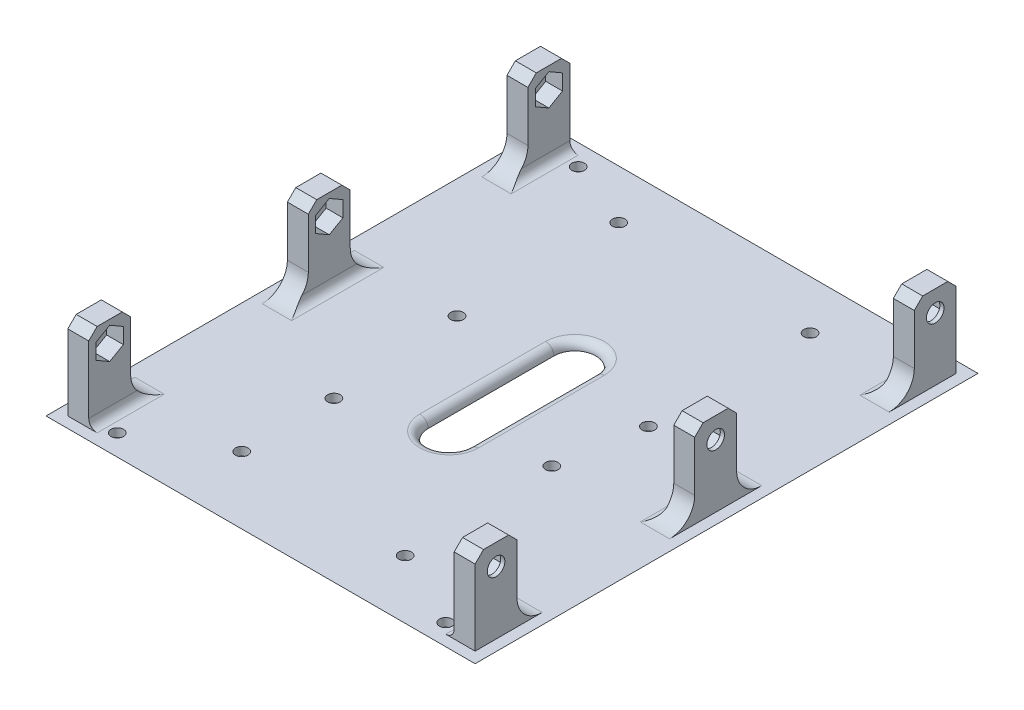
from build123d import *

# Parameters (mm, degrees)
SKETCH1_W               = 130.048
SKETCH1_H               = 152.4
BOSS_EXTRUDE1_DEPTH     = 2.54
CHAMFER1_SIZE           = 2.54
SKETCH4_W               = 6.35
SKETCH4_H               = 12.7
BOSS_EXTRUDE4_DEPTH     = 25.4
CUT_EXTRUDE2_DEPTH      = 104.996173853
CUT_EXTRUDE2_DEPTH_BACK = 104.996173853
SKETCH5_R               = 2.667
CUT_EXTRUDE3_DEPTH      = 60.452
CUT_EXTRUDE3_DEPTH_BACK = 60.452
SKETCH5_3_R             = 2.667
FILLET1_R               = 7.62
FILLET2_R               = 2.54
CHAMFER2_SIZE           = 2.54
SKETCH6_R               = 1.905
CUT_EXTRUDE4_DEPTH      = 104.996173853
SKETCH8_R               = 1.905
CUT_EXTRUDE5_DEPTH      = 2.54
SKETCH9_R               = 1.905
CUT_EXTRUDE6_DEPTH      = 104.996173853
CUT_EXTRUDE7_DEPTH      = 104.996173853
FILLET3_R               = 2.54


with BuildPart() as part:
    # Sketch1 → Boss-Extrude1 (new body)
    with BuildSketch(Plane(origin=(0, 0, 0), x_dir=(1, 0, 0), z_dir=(0, 1, 0))):
        Rectangle(SKETCH1_W, SKETCH1_H)
    extrude(amount=BOSS_EXTRUDE1_DEPTH)

    # Chamfer1
    chamfer1_edges = [part.edges().sort_by_distance(p)[0] for p in [
        (0, 0, -76.2),
        (-65.024, 0, 0),
        (0, 0, 76.2),
        (65.024, 0, 0),
    ]]
    chamfer(chamfer1_edges, length=CHAMFER1_SIZE - 0.0001)  # a hair under: the kernel refuses the full size

    # Sketch4 → Boss-Extrude4 (add)
    with BuildSketch(Plane(origin=(0, 2.54, 0), x_dir=(1, 0, 0), z_dir=(0, 1, 0))):
        with Locations((-58.547, 66.548)):
            Rectangle(SKETCH4_W, SKETCH4_H)
        with Locations((-58.547, 0)):
            Rectangle(SKETCH4_W, SKETCH4_H)
        with Locations((-58.547, -66.548)):
            Rectangle(SKETCH4_W, SKETCH4_H)
        with Locations((58.547, -66.548)):
            Rectangle(SKETCH4_W, SKETCH4_H)
        with Locations((58.547, 0)):
            Rectangle(SKETCH4_W, SKETCH4_H)
        with Locations((58.547, 66.548)):
            Rectangle(SKETCH4_W, SKETCH4_H)
    extrude(amount=BOSS_EXTRUDE4_DEPTH)

    # Sketch5 → Cut-Extrude2 (cut, two sides: drawn at the far end of the back side and taken through both)
    with BuildSketch(Plane(origin=(0, 0, 0), x_dir=(0, 0, -1), z_dir=(1, 0, 0)).offset(-CUT_EXTRUDE2_DEPTH_BACK)):
        with Locations((-66.548, 21.59)):
            Circle(SKETCH5_R)
        with Locations((0, 21.59)):
            Circle(SKETCH5_R)
        with Locations((66.548, 21.59)):
            Circle(SKETCH5_R)
    extrude(amount=CUT_EXTRUDE2_DEPTH + CUT_EXTRUDE2_DEPTH_BACK, mode=Mode.SUBTRACT)

    # Sketch5<3> → Cut-Extrude3 (cut, two sides: drawn at the far end of the back side and taken through both)
    # profile 1 of 3: a face of its own
    with BuildSketch(Plane(origin=(0, 0, 0), x_dir=(0, 0, -1), z_dir=(1, 0, 0)).offset(-CUT_EXTRUDE3_DEPTH_BACK)):
        Polygon((0, 16.823973528), (4.1275, 19.206986764), (4.1275, 23.973013236), (0, 26.356026472), (-4.1275, 23.973013236), (-4.1275, 19.206986764), align=None)
        with Locations(Location((0, 21.59, 0), (0, 0, 180))):
            Circle(SKETCH5_3_R, mode=Mode.SUBTRACT)
    # profile 2 of 3: a face of its own
    with BuildSketch(Plane(origin=(0, 0, 0), x_dir=(0, 0, -1), z_dir=(1, 0, 0)).offset(-CUT_EXTRUDE3_DEPTH_BACK)):
        Polygon((-66.548, 16.823973528), (-62.4205, 19.206986764), (-62.4205, 23.973013236), (-66.548, 26.356026472), (-70.6755, 23.973013236), (-70.6755, 19.206986764), align=None)
        with Locations(Location((-66.548, 21.59, 0), (0, 0, 180))):
            Circle(SKETCH5_3_R, mode=Mode.SUBTRACT)
    # profile 3 of 3: a face of its own
    with BuildSketch(Plane(origin=(0, 0, 0), x_dir=(0, 0, -1), z_dir=(1, 0, 0)).offset(-CUT_EXTRUDE3_DEPTH_BACK)):
        Polygon((66.548, 16.823973528), (70.6755, 19.206986764), (70.6755, 23.973013236), (66.548, 26.356026472), (62.4205, 23.973013236), (62.4205, 19.206986764), align=None)
        with Locations(Location((66.548, 21.59, 0), (0, 0, 180))):
            Circle(SKETCH5_3_R, mode=Mode.SUBTRACT)
    extrude(amount=CUT_EXTRUDE3_DEPTH + CUT_EXTRUDE3_DEPTH_BACK, mode=Mode.SUBTRACT)

    # Fillet1
    fillet1_edges = [part.edges().sort_by_distance(p)[0] for p in [
        (-58.547, 2.54, -60.198),
        (-58.547, 2.54, 6.35),
        (-58.547, 2.54, -6.35),
        (-58.547, 2.54, 60.198),
        (58.547, 2.54, 60.198),
        (58.547, 2.54, -6.35),
        (58.547, 2.54, 6.35),
        (58.547, 2.54, -60.198),
    ]]
    fillet(fillet1_edges, radius=FILLET1_R)

    # Fillet2
    fillet2_edges = [part.edges().sort_by_distance(p)[0] for p in [
        (-55.372, 2.54, -62.738),
        (-55.372, 2.54, 0),
        (-55.372, 2.54, 62.738),
        (55.372, 2.54, 62.738),
        (55.372, 2.54, 0),
        (55.372, 2.54, -62.738),
    ]]
    fillet(fillet2_edges, radius=FILLET2_R)

    # Chamfer2
    chamfer2_edges = [part.edges().sort_by_distance(p)[0] for p in [
        (-58.547, 27.94, -60.198),
        (-58.547, 27.94, -72.898),
        (-58.547, 27.94, 6.35),
        (-58.547, 27.94, -6.35),
        (-58.547, 27.94, 72.898),
        (-58.547, 27.94, 60.198),
        (58.547, 27.94, 60.198),
        (58.547, 27.94, 72.898),
        (58.547, 27.94, -6.35),
        (58.547, 27.94, 6.35),
        (58.547, 27.94, -72.898),
        (58.547, 27.94, -60.198),
    ]]
    chamfer(chamfer2_edges, length=CHAMFER2_SIZE)

    # Sketch6 → Cut-Extrude4 (cut, through all)
    with BuildSketch(Plane.XZ):
        with Locations(Location((26.035, 58.42, 0), (0, 0, 270))):
            Circle(SKETCH6_R)
        with Locations(Location((24.765, 12.7, 0), (0, 0, 270))):
            Circle(SKETCH6_R)
        with Locations(Location((-26.035, 55.88, 0), (0, 0, 270))):
            Circle(SKETCH6_R)
        with Locations(Location((-26.035, 27.94, 0), (0, 0, 270))):
            Circle(SKETCH6_R)
    extrude(amount=-CUT_EXTRUDE4_DEPTH, mode=Mode.SUBTRACT)

    # Sketch8 → Cut-Extrude5 (cut)
    with BuildSketch(Plane.XZ):
        with Locations(Location((29, -12.33, 0), (0, 0, 270))):
            Circle(SKETCH8_R)
        with Locations(Location((29, -61.33, 0), (0, 0, 270))):
            Circle(SKETCH8_R)
        with Locations(Location((-29, -61.33, 0), (0, 0, 270))):
            Circle(SKETCH8_R)
        with Locations(Location((-29, -12.33, 0), (0, 0, 270))):
            Circle(SKETCH8_R)
    extrude(amount=-CUT_EXTRUDE5_DEPTH, mode=Mode.SUBTRACT)

    # Sketch9 → Cut-Extrude6 (cut, through all)
    with BuildSketch(Plane.XZ):
        with Locations(Location((-49.784, -69.85, 0), (0, 0, 270))):
            Circle(SKETCH9_R)
        with Locations(Location((-49.784, 69.85, 0), (0, 0, 270))):
            Circle(SKETCH9_R)
        with Locations(Location((49.784, 69.85, 0), (0, 0, 270))):
            Circle(SKETCH9_R)
        with Locations(Location((49.784, -69.85, 0), (0, 0, 270))):
            Circle(SKETCH9_R)
    extrude(amount=-CUT_EXTRUDE6_DEPTH, mode=Mode.SUBTRACT)

    # Sketch10 → Cut-Extrude7 (cut, through all)
    with BuildSketch(Plane.XZ):
        with BuildLine():
            Line((-6.35, -19.05), (-6.35, 19.05))
            ThreePointArc((-6.35, 19.05), (0, 25.4), (6.35, 19.05))
            Line((6.35, 19.05), (6.35, -19.05))
            ThreePointArc((6.35, -19.05), (0, -25.4), (-6.35, -19.05))
        make_face()
    extrude(amount=-CUT_EXTRUDE7_DEPTH, mode=Mode.SUBTRACT)

    # Fillet3
    fillet3_edges = [part.edges().sort_by_distance(p)[0] for p in [
        (0, 2.54, 25.4),
        (6.35, 2.54, 0),
        (0, 2.54, -25.4),
        (-6.35, 2.54, 0),
    ]]
    fillet(fillet3_edges, radius=FILLET3_R - 0.0001)  # a hair under: the kernel refuses the full size


solid = part.part
